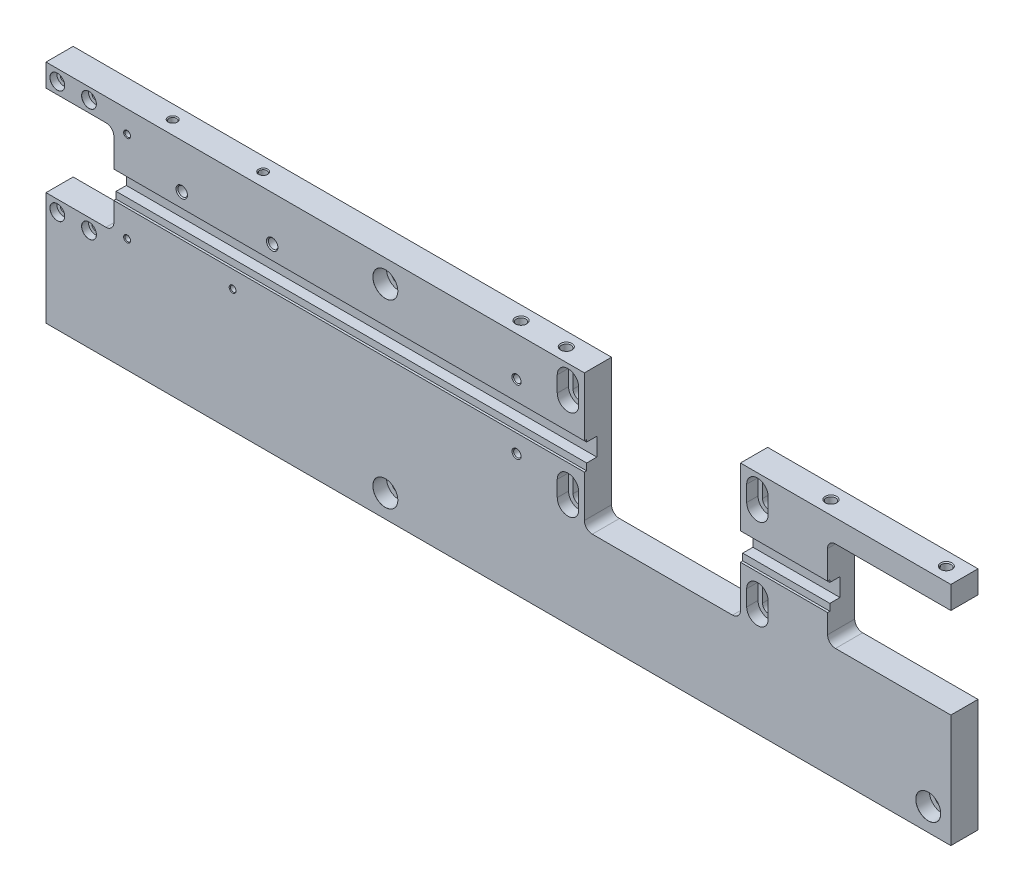
from build123d import *

# Parameters (mm, degrees)
SKETCH1_W                       = 400
SKETCH1_H                       = 100
BASE_DEPTH                      = 12
PART_TAPE_MOVER_CUTOUT_DEPTH    = 207.504237245
PRESS_PLATE_CUTOUT_DEPTH        = 207.504237245
ROLLER_CUTOUT_DEPTH             = 207.504237245
SKETCH5_W                       = 315.5
SKETCH5_H                       = 8
PART_TAPE_CUTOUT_DEPTH          = 5.5
SKETCH6_W                       = 315.5
SKETCH6_H                       = 12
PART_TAPE_REST_DEPTH            = 1
CBORE_FOR_M6_SHCS1_AT_2_COUNT   = 2
CBORE_FOR_M6_SHCS1_AT_2_PITCH   = 240
CBORE_FOR_M6_SHCS1_AT_3_COUNT   = 2
CBORE_FOR_M6_SHCS1_AT_3_PITCH   = 252.982212813
LPATTERN2_COUNT                 = 2
LPATTERN2_PITCH                 = 14
LPATTERN2_COUNT_DIR2            = 2
LPATTERN2_PITCH_DIR2            = 50
M5X0_8_TAPPED_HOLE1_D           = 4.2
M5X0_8_TAPPED_HOLE1_DEPTH       = 10
M5X0_8_TAPPED_HOLE1_CSINK_D     = 5.05
M5X0_8_TAPPED_HOLE1_CSINK_ANGLE = 90
M5X0_8_TAPPED_HOLE1_TIP         = 1.2618073
M4X0_7_TAPPED_HOLE1_D           = 3.3
M4X0_7_TAPPED_HOLE1_DEPTH       = 10.1
M4X0_7_TAPPED_HOLE1_CSINK_D     = 4.05
M4X0_7_TAPPED_HOLE1_CSINK_ANGLE = 90
M4X0_7_TAPPED_HOLE1_TIP         = 0.991420021
M3X0_5_TAPPED_HOLE1_D           = 2.5
M3X0_5_TAPPED_HOLE1_CSINK_D     = 3.05
M3X0_5_TAPPED_HOLE1_CSINK_ANGLE = 90
M5X0_8_TAPPED_HOLE2_D           = 4.2
M5X0_8_TAPPED_HOLE2_CSINK_D     = 5.05
M5X0_8_TAPPED_HOLE2_CSINK_ANGLE = 90
M4X0_7_TAPPED_HOLE2_D           = 3.3
M4X0_7_TAPPED_HOLE2_CSINK_D     = 4.05
M4X0_7_TAPPED_HOLE2_CSINK_ANGLE = 90
CBORE_SLOT_FOR_M5_SHCS2_DEPTH   = 12
CBORE_START                     = 7
CBORE_SLOT_FOR_M5_SHCS2_2_DEPTH = 5
LPATTERN3_COUNT                 = 2
LPATTERN3_PITCH                 = 83.75
LPATTERN3_COUNT_DIR2            = 2
LPATTERN3_PITCH_DIR2            = 40


# Read off the part's stored shape, not the designer's step: CBORE SLOT for M5 SHCS2
with BuildPart() as part:
    # Sketch1 → Base (new body)
    with BuildSketch(Plane.XY):
        Rectangle(SKETCH1_W, SKETCH1_H)
    extrude(amount=BASE_DEPTH)

    # Sketch2 → Part Tape Mover Cutout (cut, through all)
    with BuildSketch(Plane.XY.offset(12)):
        with BuildLine():
            Line((200, 0), (149, 0))
            ThreePointArc((149, 0), (146.525126266, 1.025126266), (145.5, 3.5))
            Line((145.5, 3.5), (145.5, 36.5))
            ThreePointArc((145.5, 36.5), (146.525126266, 38.974873734), (149, 40))
            Line((149, 40), (200, 40))
            Line((200, 40), (200, 0))
        make_face()
    extrude(amount=-PART_TAPE_MOVER_CUTOUT_DEPTH, mode=Mode.SUBTRACT)

    # Sketch3 → Press Plate Cutout (cut, through all)
    with BuildSketch(Plane.XY.offset(12)):
        with BuildLine():
            Line((41.5, -10), (103.5, -10))
            ThreePointArc((103.5, -10), (105.974873734, -8.974873734), (107, -6.5))
            Line((107, -6.5), (107, 50))
            Line((107, 50), (38, 50))
            Line((38, 50), (38, -6.5))
            ThreePointArc((38, -6.5), (39.025126266, -8.974873734), (41.5, -10))
        make_face()
    extrude(amount=-PRESS_PLATE_CUTOUT_DEPTH, mode=Mode.SUBTRACT)

    # Sketch4 → Roller Cutout (cut, through all)
    with BuildSketch(Plane.XY.offset(12)):
        with BuildLine():
            Line((-200, 40), (-173.5, 40))
            ThreePointArc((-173.5, 40), (-171.025126266, 38.974873734), (-170, 36.5))
            Line((-170, 36.5), (-170, 3.5))
            ThreePointArc((-170, 3.5), (-171.025126266, 1.025126266), (-173.5, 0))
            Line((-173.5, 0), (-200, 0))
            Line((-200, 0), (-200, 40))
        make_face()
    extrude(amount=-ROLLER_CUTOUT_DEPTH, mode=Mode.SUBTRACT)

    # Sketch5 → Part Tape Cutout (cut)
    with BuildSketch(Plane.XY.offset(12)):
        with Locations((-12.25, 19)):
            Rectangle(SKETCH5_W, SKETCH5_H)
    extrude(amount=-PART_TAPE_CUTOUT_DEPTH, mode=Mode.SUBTRACT)

    # Sketch6 → Part Tape Rest (cut)
    with BuildSketch(Plane.XY.offset(12)):
        with Locations((-12.25, 18)):
            Rectangle(SKETCH6_W, SKETCH6_H)
    extrude(amount=-PART_TAPE_REST_DEPTH, mode=Mode.SUBTRACT)

    # Sketch16 → CBORE for M6 SHCS1 (revolve, cut)
    with BuildSketch(Plane(origin=(190, -40, 12), x_dir=(0, -1, 0), z_dir=(1, 0, 0))):
        Polygon((0, 0), (0, 12), (3.3, 12), (3.3, 6), (5.5, 6), (5.5, 0.025), (5.525, 0), align=None)
    cbore_for_m6_shcs1 = revolve(axis=Axis((190, -40, 18.35), (0, 0, -1)), mode=Mode.SUBTRACT)

    # CBORE for M6 SHCS1 at 2: CBORE for M6 SHCS1 ×2
    with Locations(*[(-i * CBORE_FOR_M6_SHCS1_AT_2_PITCH, 0, 0) for i in range(1, CBORE_FOR_M6_SHCS1_AT_2_COUNT)]):
        add(cbore_for_m6_shcs1, mode=Mode.SUBTRACT)

    # CBORE for M6 SHCS1 at 3: CBORE for M6 SHCS1 ×2
    with Locations(*[Vector(-0.9486832980505139, 0.316227766016838, 0) * (i * CBORE_FOR_M6_SHCS1_AT_3_PITCH) for i in range(1, CBORE_FOR_M6_SHCS1_AT_3_COUNT)]):
        add(cbore_for_m6_shcs1, mode=Mode.SUBTRACT)

    # Sketch18 → CBORE for M3 SHCS2 (revolve, cut)
    with BuildSketch(Plane(origin=(-195, 45, 12), x_dir=(0, -1, 0), z_dir=(1, 0, 0))):
        Polygon((0, 0), (0, 12), (1.7, 12), (1.7, 3), (3.25, 3), (3.25, 0.025), (3.275, 0), align=None)
    cbore_for_m3_shcs2 = revolve(axis=Axis((-195, 45, 18.35), (0, 0, -1)), mode=Mode.SUBTRACT)

    # LPattern2: CBORE for M3 SHCS2 2 × 2
    with Locations(*[(i * LPATTERN2_PITCH, -j * LPATTERN2_PITCH_DIR2, 0) for i in range(LPATTERN2_COUNT) for j in range(LPATTERN2_COUNT_DIR2) if (i, j) != (0, 0)]):
        add(cbore_for_m3_shcs2, mode=Mode.SUBTRACT)

    # M5x0.8 Tapped Hole1
    with Locations(Plane(origin=(0, 50, 0), x_dir=(1, 0, 0), z_dir=(0, 1, 0))):
        with Locations((192, -6), (141, -6), (24, -6), (4, -6)):
            CounterSinkHole(M5X0_8_TAPPED_HOLE1_D / 2, M5X0_8_TAPPED_HOLE1_CSINK_D / 2, depth=M5X0_8_TAPPED_HOLE1_DEPTH, counter_sink_angle=M5X0_8_TAPPED_HOLE1_CSINK_ANGLE)
            with Locations((0, 0, -(M5X0_8_TAPPED_HOLE1_DEPTH + M5X0_8_TAPPED_HOLE1_TIP / 2))):  # 118° drill point
                Cone(0, M5X0_8_TAPPED_HOLE1_D / 2, M5X0_8_TAPPED_HOLE1_TIP, mode=Mode.SUBTRACT)

    # M4x0.7 Tapped Hole1
    with Locations(Plane(origin=(0, 50, 0), x_dir=(1, 0, 0), z_dir=(0, 1, 0))):
        with Locations((-150, -6), (-110, -6)):
            CounterSinkHole(M4X0_7_TAPPED_HOLE1_D / 2, M4X0_7_TAPPED_HOLE1_CSINK_D / 2, depth=M4X0_7_TAPPED_HOLE1_DEPTH, counter_sink_angle=M4X0_7_TAPPED_HOLE1_CSINK_ANGLE)
            with Locations((0, 0, -(M4X0_7_TAPPED_HOLE1_DEPTH + M4X0_7_TAPPED_HOLE1_TIP / 2))):  # 118° drill point
                Cone(0, M4X0_7_TAPPED_HOLE1_D / 2, M4X0_7_TAPPED_HOLE1_TIP, mode=Mode.SUBTRACT)

    # M3x0.5 Tapped Hole1 (through all)
    with Locations(Plane.XY.offset(12)):
        with Locations((-164.15, 40.25), (-117.5, 4.3), (-164.15, 0.25)):
            CounterSinkHole(M3X0_5_TAPPED_HOLE1_D / 2, M3X0_5_TAPPED_HOLE1_CSINK_D / 2, counter_sink_angle=M3X0_5_TAPPED_HOLE1_CSINK_ANGLE)

    # M5x0.8 Tapped Hole2 (through all)
    with Locations(Plane.XY.offset(12)):
        with Locations((-140, 30.25), (-100, 30.25)):
            CounterSinkHole(M5X0_8_TAPPED_HOLE2_D / 2, M5X0_8_TAPPED_HOLE2_CSINK_D / 2, counter_sink_angle=M5X0_8_TAPPED_HOLE2_CSINK_ANGLE)

    # M4x0.7 Tapped Hole2 (through all)
    with Locations(Plane.XY.offset(12)):
        with Locations((8, 32.5), (8, 4)):
            CounterSinkHole(M4X0_7_TAPPED_HOLE2_D / 2, M4X0_7_TAPPED_HOLE2_CSINK_D / 2, counter_sink_angle=M4X0_7_TAPPED_HOLE2_CSINK_ANGLE)

    # CBORE SLOT for M5 SHCS2 outline → CBORE SLOT for M5 SHCS2 (cut)
    with BuildSketch(Plane.XY):
        with BuildLine():
            Line((117.25, 36.25), (117.25, 43.25))
            ThreePointArc((117.25, 43.25), (114.5, 46), (111.75, 43.25))
            Line((111.75, 43.25), (111.75, 36.25))
            ThreePointArc((111.75, 36.25), (114.5, 33.5), (117.25, 36.25))
        make_face()
    cbore_slot_for_m5_shcs2 = extrude(amount=CBORE_SLOT_FOR_M5_SHCS2_DEPTH, mode=Mode.SUBTRACT)

    # CBORE SLOT for M5 SHCS2 2 outline → CBORE SLOT for M5 SHCS2 2 (cut)
    with BuildSketch(Plane.XY.offset(CBORE_START)):
        with BuildLine():
            Line((119.25, 36.25), (119.25, 43.25))
            ThreePointArc((119.25, 43.25), (114.5, 48), (109.75, 43.25))
            Line((109.75, 43.25), (109.75, 36.25))
            ThreePointArc((109.75, 36.25), (114.5, 31.5), (119.25, 36.25))
        make_face()
        with BuildLine():
            ThreePointArc((111.75, 43.25), (114.5, 46), (117.25, 43.25))
            Line((117.25, 43.25), (117.25, 36.25))
            ThreePointArc((117.25, 36.25), (114.5, 33.5), (111.75, 36.25))
            Line((111.75, 36.25), (111.75, 43.25))
        make_face(mode=Mode.SUBTRACT)
    cbore_slot_for_m5_shcs2_2 = extrude(amount=CBORE_SLOT_FOR_M5_SHCS2_2_DEPTH, mode=Mode.SUBTRACT)

    # LPattern3: CBORE SLOT for M5 SHCS2, CBORE SLOT for M5 SHCS2 2 2 × 2
    with Locations(*[(-i * LPATTERN3_PITCH, -j * LPATTERN3_PITCH_DIR2, 0) for i in range(LPATTERN3_COUNT) for j in range(LPATTERN3_COUNT_DIR2) if (i, j) != (0, 0)]):
        add(cbore_slot_for_m5_shcs2, mode=Mode.SUBTRACT)
        add(cbore_slot_for_m5_shcs2_2, mode=Mode.SUBTRACT)


solid = part.part
